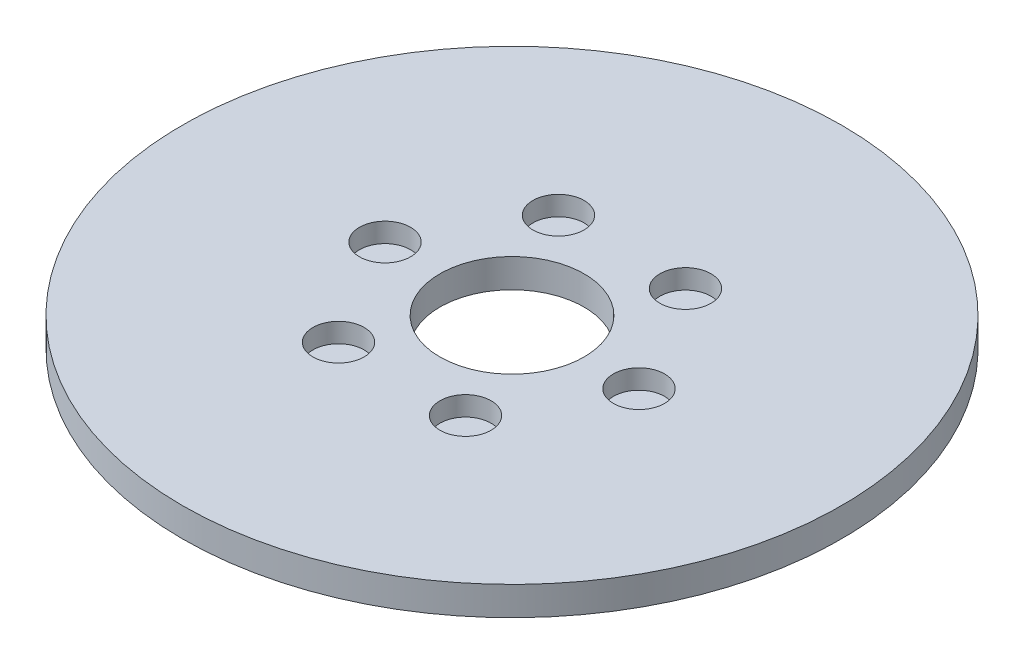
from build123d import *

# Parameters (mm, degrees)
SKETCH1_R           = 80
BOSS_EXTRUDE1_DEPTH = 7
SKETCH2_R           = 17.5
CUT_EXTRUDE1_DEPTH  = 114.353429591
SKETCH3_R           = 6.213687844
CUT_EXTRUDE2_DEPTH  = 4.726910953
CIRPATTERN1_COUNT   = 6


with BuildPart() as part:
    # Sketch1 → Boss-Extrude1 (new body)
    with BuildSketch(Plane(origin=(0, 0, 0), x_dir=(1, 0, 0), z_dir=(0, 1, 0))):
        Circle(SKETCH1_R)
    extrude(amount=BOSS_EXTRUDE1_DEPTH)

    # Sketch2 → Cut-Extrude1 (cut, through all)
    with BuildSketch(Plane(origin=(0, 0, 0), x_dir=(1, 0, 0), z_dir=(0, 1, 0))):
        Circle(SKETCH2_R)
    extrude(amount=CUT_EXTRUDE1_DEPTH, mode=Mode.SUBTRACT)

    # Sketch3 → Cut-Extrude2 (cut)
    with BuildSketch(Plane(origin=(0, 7, 0), x_dir=(1, 0, 0), z_dir=(0, 1, 0))):
        with Locations((-30.824532404, 0)):
            Circle(SKETCH3_R)
    cut_extrude2 = extrude(amount=-CUT_EXTRUDE2_DEPTH, mode=Mode.SUBTRACT)

    # CirPattern1: Cut-Extrude2 ×6 about axis
    cirpattern1_axis = Axis((0, 0, 0), (0, 1, 0))
    for i in range(1, CIRPATTERN1_COUNT):
        add(cut_extrude2.rotate(cirpattern1_axis, i * 360 / CIRPATTERN1_COUNT), mode=Mode.SUBTRACT)


solid = part.part
